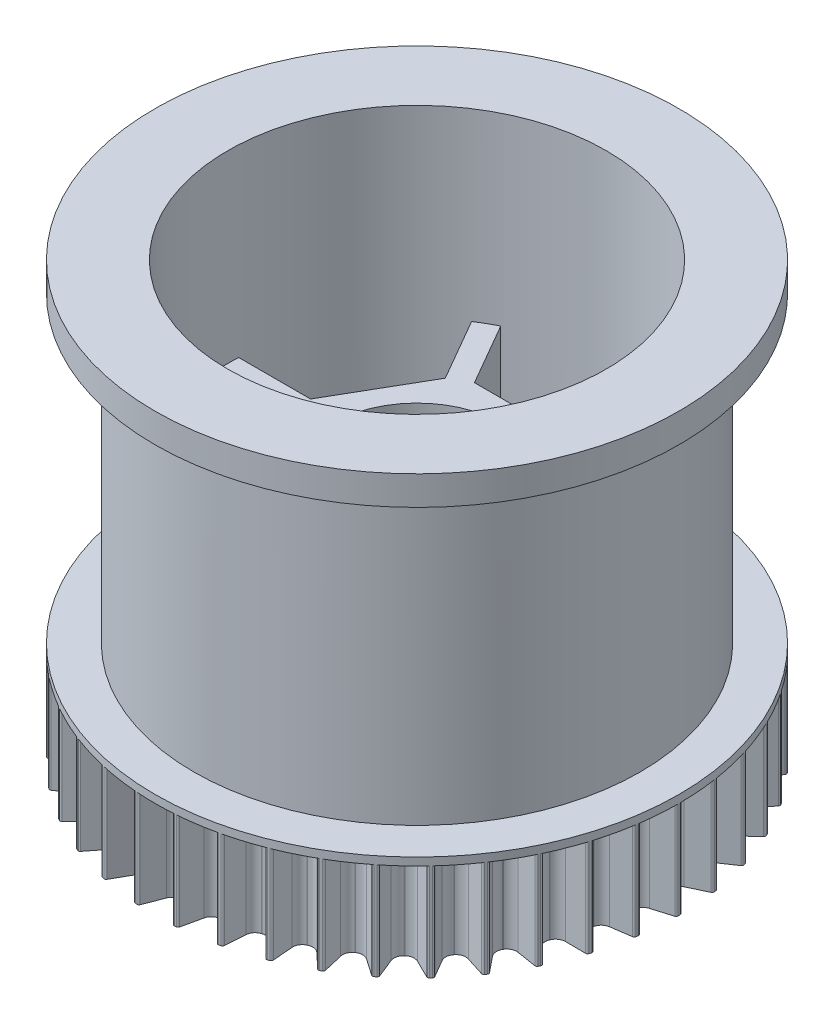
from build123d import *

# Parameters (mm, degrees)
SKETCH_1_R          = 4.4
EXTRUDE_1_DEPTH     = 5
SKETCH_2_R          = 13.5
SKETCH_2_R_2        = 11.2
EXTRUDE_2_DEPTH     = 0.4
SKETCH_2_2_R        = 11.5
SKETCH_2_2_R_2      = 10.9
EXTRUDE_2_2_DEPTH   = 16
SKETCH_5_R          = 13.5
SKETCH_5_R_2        = 10.9
EXTRUDE_3_DEPTH     = 1.5
SKETCH_6_R          = 4.4
EXTRUDE_4_DEPTH     = 8
SKETCH_1_6_R        = 4.4
SKETCH_1_6_R_2      = 3.5
EXTRUDE_5_DEPTH     = 13
SKETCH_1_7_R        = 4.4
SKETCH_1_7_R_2      = 3.5
CUT_EXTRUDE_1_DEPTH = 3
CUT_EXTRUDE_START   = -3
SKETCH_8_R          = 4.4
SKETCH_8_R_2        = 3.5
CUT_EXTRUDE_2_DEPTH = 3
EXTRUDE_7_REACH     = 31.508
SKETCH_9_R          = 11.5
SKETCH_9_R_2        = 9.75


with BuildPart() as part:
    # 草图1 → 凸台-拉伸1 (new body)
    with BuildSketch(Plane(origin=(0, 0, 0), x_dir=(1, 0, 0), z_dir=(0, 1, 0))):
        with BuildLine():
            Line((12.421648835, 0.449416948), (13.428727986, 0.146279171))
            ThreePointArc((13.428727986, 0.146279171), (13.480048996, 0.110330314), (13.499904043, 0.050900158))
            ThreePointArc((13.499904043, 0.050900158), (13.5, 0), (13.499904043, -0.050900158))
            ThreePointArc((13.499904043, -0.050900158), (13.480048996, -0.110330314), (13.428727986, -0.146279171))
            Line((13.428727986, -0.146279171), (12.421648835, -0.449416948))
            ThreePointArc((12.421648835, -0.449416948), (12.175747513, -0.615329239), (12.067123529, -0.89136398))
            ThreePointArc((12.067123529, -0.89136398), (12.066165946, -0.904234132), (12.065194637, -0.917103256))
            ThreePointArc((12.065194637, -0.917103256), (12.131464538, -1.206244482), (12.349891401, -1.40695336))
            Line((12.349891401, -1.40695336), (13.300541969, -1.856802698))
            ThreePointArc((13.300541969, -1.856802698), (13.345931866, -1.899999035), (13.356707544, -1.961724646))
            ThreePointArc((13.356707544, -1.961724646), (13.349216154, -2.012070593), (13.341534994, -2.062387937))
            ThreePointArc((13.341534994, -2.062387937), (13.313044106, -2.118195066), (13.256938411, -2.146093404))
            Line((13.256938411, -2.146093404), (12.21592716, -2.295748024))
            ThreePointArc((12.21592716, -2.295748024), (11.948044409, -2.423157522), (11.799492821, -2.679919618))
            ThreePointArc((11.799492821, -2.679919618), (11.796627737, -2.692503301), (11.793749233, -2.705083921))
            ThreePointArc((11.793749233, -2.705083921), (11.816184691, -3.000872694), (12.0022578, -3.231894655))
            Line((12.0022578, -3.231894655), (12.875243823, -3.818406662))
            ThreePointArc((12.875243823, -3.818406662), (12.913688672, -3.867885545), (12.915144269, -3.930527764))
            ThreePointArc((12.915144269, -3.930527764), (12.900232878, -3.979194855), (12.885138099, -4.027805378))
            ThreePointArc((12.885138099, -4.027805378), (12.84864781, -4.07874284), (12.789010738, -4.097967457))
            Line((12.789010738, -4.097967457), (11.737321858, -4.090795883))
            ThreePointArc((11.737321858, -4.090795883), (11.453441736, -4.176856469), (11.268280943, -4.40861028))
            ThreePointArc((11.268280943, -4.40861028), (11.263572359, -4.420626395), (11.258850961, -4.432637481))
            ThreePointArc((11.258850961, -4.432637481), (11.236950804, -4.72846637), (11.386513594, -4.984640763))
            Line((11.386513594, -4.984640763), (12.162334005, -5.694713732))
            ThreePointArc((12.162334005, -5.694713732), (12.192975012, -5.749369884), (12.185078013, -5.811529386))
            ThreePointArc((12.185078013, -5.811529386), (12.163079717, -5.857430478), (12.140908512, -5.903248302))
            ThreePointArc((12.140908512, -5.903248302), (12.097233954, -5.94817824), (12.035397698, -5.958299689))
            Line((12.035397698, -5.958299689), (10.996524182, -5.794462121))
            ThreePointArc((10.996524182, -5.794462121), (10.702988102, -5.837251346), (10.485354288, -6.038819873))
            ThreePointArc((10.485354288, -6.038819873), (10.478907386, -6.05), (10.472448563, -6.061173244))
            ThreePointArc((10.472448563, -6.061173244), (10.406702004, -6.35043392), (10.51641349, -6.626038234))
            Line((10.51641349, -6.626038234), (11.177737743, -7.443810306))
            ThreePointArc((11.177737743, -7.443810306), (11.199890439, -7.5024228), (11.18281725, -7.562711045))
            ThreePointArc((11.18281725, -7.562711045), (11.154223453, -7.604820784), (11.12547109, -7.646822414))
            ThreePointArc((11.12547109, -7.646822414), (11.075587881, -7.684741166), (11.012933761, -7.685533352))
            Line((11.012933761, -7.685533352), (10.010082327, -7.368689651))
            ThreePointArc((10.010082327, -7.368689651), (9.713447399, -7.367251672), (9.468202145, -7.534132209))
            ThreePointArc((9.468202145, -7.534132209), (9.460160938, -7.544226602), (9.452108969, -7.554312413))
            ThreePointArc((9.452108969, -7.554312413), (9.343984679, -7.83054327), (9.411394086, -8.11942096))
            Line((9.411394086, -8.11942096), (9.943449291, -9.026624459))
            ThreePointArc((9.943449291, -9.026624459), (9.956618821, -9.087883988), (9.930750828, -9.144954237))
            ThreePointArc((9.930750828, -9.144954237), (9.89620027, -9.18233196), (9.861509029, -9.219579149))
            ThreePointArc((9.861509029, -9.219579149), (9.806531477, -9.249639674), (9.744459083, -9.241084899))
            Line((9.744459083, -9.241084899), (8.800031773, -8.778312831))
            ThreePointArc((8.800031773, -8.778312831), (8.506924332, -8.732679771), (8.239546012, -8.861144482))
            ThreePointArc((8.239546012, -8.861144482), (8.230090127, -8.869927649), (8.22062488, -8.878700726))
            ThreePointArc((8.22062488, -8.878700726), (8.072538176, -9.135731223), (8.09613969, -9.431429239))
            Line((8.09613969, -9.431429239), (8.487040612, -10.407798738))
            ThreePointArc((8.487040612, -10.407798738), (8.49093279, -10.470336865), (8.456847843, -10.522914262))
            ThreePointArc((8.456847843, -10.522914262), (8.417112325, -10.554725013), (8.377257151, -10.586385721))
            ThreePointArc((8.377257151, -10.586385721), (8.318413365, -10.607916516), (8.258309291, -10.59020588))
            Line((8.258309291, -10.59020588), (7.393403052, -9.991843007))
            ThreePointArc((7.393403052, -9.991843007), (7.110370633, -9.903034234), (6.826832036, -9.990213429))
            ThreePointArc((6.826832036, -9.990213429), (6.816172703, -9.997489169), (6.805505615, -10.004753536))
            ThreePointArc((6.805505615, -10.004753536), (6.620764509, -10.236842037), (6.600030911, -10.532754974))
            Line((6.600030911, -10.532754974), (6.841045471, -11.556479991))
            ThreePointArc((6.841045471, -11.556479991), (6.835573353, -11.618899718), (6.794032851, -11.665809771))
            ThreePointArc((6.794032851, -11.665809771), (6.75, -11.691342951), (6.705871192, -11.716709929))
            ThreePointArc((6.705871192, -11.716709929), (6.644475643, -11.729230032), (6.587682515, -11.702759162))
            Line((6.587682515, -11.702759162), (5.821617923, -10.982171922))
            ThreePointArc((5.821617923, -10.982171922), (5.554983004, -10.852171276), (5.261617913, -10.896117516))
            ThreePointArc((5.261617913, -10.896117516), (5.249993243, -10.901723302), (5.238362601, -10.907316685))
            ThreePointArc((5.238362601, -10.907316685), (5.021093904, -11.109278715), (4.956488349, -11.398796367))
            Line((4.956488349, -11.398796367), (5.042232678, -12.447008578))
            ThreePointArc((5.042232678, -12.447008578), (5.027518502, -12.507915551), (4.979450393, -12.548110367))
            ThreePointArc((4.979450393, -12.548110367), (4.932103829, -12.566795607), (4.884687151, -12.585302199))
            ThreePointArc((4.884687151, -12.585302199), (4.822111316, -12.588531931), (4.769897799, -12.553892142))
            Line((4.769897799, -12.553892142), (4.11978747, -11.727177263))
            ThreePointArc((4.11978747, -11.727177263), (3.875506233, -11.558888745), (3.578867941, -11.558620344))
            ThreePointArc((3.578867941, -11.558620344), (3.56653761, -11.56243095), (3.554203222, -11.566228402))
            ThreePointArc((3.554203222, -11.566228402), (3.309260359, -11.733552465), (3.202226027, -12.010207485))
            Line((3.202226027, -12.010207485), (3.13078474, -13.059491561))
            ThreePointArc((3.13078474, -13.059491561), (3.107157195, -13.117525219), (3.053635241, -13.150106913))
            ThreePointArc((3.053635241, -13.150106913), (3.004032608, -13.161526814), (2.954387271, -13.172759614))
            ThreePointArc((2.954387271, -13.172759614), (2.89202899, -13.166626828), (2.845561447, -13.124591917))
            Line((2.845561447, -13.124591917), (2.325927773, -12.210216843))
            ThreePointArc((2.325927773, -12.210216843), (2.109457058, -12.007399739), (1.816171974, -11.962922693))
            ThreePointArc((1.816171974, -11.962922693), (1.803411421, -11.964852997), (1.790648816, -11.96676969))
            ThreePointArc((1.790648816, -11.96676969), (1.523503405, -12.095718042), (1.376431267, -12.353330415))
            Line((1.376431267, -12.353330415), (1.149400244, -13.380247083))
            ThreePointArc((1.149400244, -13.380247083), (1.117387131, -13.43411105), (1.059606923, -13.4583518))
            ThreePointArc((1.059606923, -13.4583518), (1.008856263, -13.462251262), (0.958091262, -13.465959347))
            ThreePointArc((0.958091262, -13.465959347), (0.897343515, -13.45060104), (0.857659955, -13.402109995))
            Line((0.857659955, -13.402109995), (0.480110693, -12.420500356))
            ThreePointArc((0.480110693, -12.420500356), (0.296286097, -12.187685265), (0.012905725, -12.099993117))
            ThreePointArc((0.012905725, -12.099993117), (0, -12.1), (-0.012905725, -12.099993117))
            ThreePointArc((-0.012905725, -12.099993117), (-0.296286097, -12.187685265), (-0.480110693, -12.420500356))
            Line((-0.480110693, -12.420500356), (-0.857659955, -13.402109995))
            ThreePointArc((-0.857659955, -13.402109995), (-0.897343515, -13.45060104), (-0.958091262, -13.465959347))
            ThreePointArc((-0.958091262, -13.465959347), (-1.008856263, -13.462251262), (-1.059606923, -13.4583518))
            ThreePointArc((-1.059606923, -13.4583518), (-1.117387131, -13.43411105), (-1.149400244, -13.380247083))
            Line((-1.149400244, -13.380247083), (-1.376431267, -12.353330415))
            ThreePointArc((-1.376431267, -12.353330415), (-1.523503405, -12.095718042), (-1.790648816, -11.96676969))
            ThreePointArc((-1.790648816, -11.96676969), (-1.803411421, -11.964852997), (-1.816171974, -11.962922693))
            ThreePointArc((-1.816171974, -11.962922693), (-2.109457058, -12.007399739), (-2.325927773, -12.210216843))
            Line((-2.325927773, -12.210216843), (-2.845561447, -13.124591917))
            ThreePointArc((-2.845561447, -13.124591917), (-2.89202899, -13.166626828), (-2.954387271, -13.172759614))
            ThreePointArc((-2.954387271, -13.172759614), (-3.004032608, -13.161526814), (-3.053635241, -13.150106913))
            ThreePointArc((-3.053635241, -13.150106913), (-3.107157195, -13.117525219), (-3.13078474, -13.059491561))
            Line((-3.13078474, -13.059491561), (-3.202226027, -12.010207485))
            ThreePointArc((-3.202226027, -12.010207485), (-3.309260359, -11.733552465), (-3.554203222, -11.566228402))
            ThreePointArc((-3.554203222, -11.566228402), (-3.56653761, -11.56243095), (-3.578867941, -11.558620344))
            ThreePointArc((-3.578867941, -11.558620344), (-3.875506233, -11.558888745), (-4.11978747, -11.727177263))
            Line((-4.11978747, -11.727177263), (-4.769897799, -12.553892142))
            ThreePointArc((-4.769897799, -12.553892142), (-4.822111316, -12.588531931), (-4.884687151, -12.585302199))
            ThreePointArc((-4.884687151, -12.585302199), (-4.932103829, -12.566795607), (-4.979450393, -12.548110367))
            ThreePointArc((-4.979450393, -12.548110367), (-5.027518502, -12.507915551), (-5.042232678, -12.447008578))
            Line((-5.042232678, -12.447008578), (-4.956488349, -11.398796367))
            ThreePointArc((-4.956488349, -11.398796367), (-5.021093904, -11.109278715), (-5.238362601, -10.907316685))
            ThreePointArc((-5.238362601, -10.907316685), (-5.249993243, -10.901723302), (-5.261617913, -10.896117516))
            ThreePointArc((-5.261617913, -10.896117516), (-5.554983004, -10.852171276), (-5.821617923, -10.982171922))
            Line((-5.821617923, -10.982171922), (-6.587682515, -11.702759162))
            ThreePointArc((-6.587682515, -11.702759162), (-6.644475643, -11.729230032), (-6.705871192, -11.716709929))
            ThreePointArc((-6.705871192, -11.716709929), (-6.75, -11.691342951), (-6.794032851, -11.665809771))
            ThreePointArc((-6.794032851, -11.665809771), (-6.835573353, -11.618899718), (-6.841045471, -11.556479991))
            Line((-6.841045471, -11.556479991), (-6.600030911, -10.532754974))
            ThreePointArc((-6.600030911, -10.532754974), (-6.620764509, -10.236842037), (-6.805505615, -10.004753536))
            ThreePointArc((-6.805505615, -10.004753536), (-6.816172703, -9.997489169), (-6.826832036, -9.990213429))
            ThreePointArc((-6.826832036, -9.990213429), (-7.110370633, -9.903034234), (-7.393403052, -9.991843007))
            Line((-7.393403052, -9.991843007), (-8.258309291, -10.59020588))
            ThreePointArc((-8.258309291, -10.59020588), (-8.318413365, -10.607916516), (-8.377257151, -10.586385721))
            ThreePointArc((-8.377257151, -10.586385721), (-8.417112325, -10.554725013), (-8.456847843, -10.522914262))
            ThreePointArc((-8.456847843, -10.522914262), (-8.49093279, -10.470336865), (-8.487040612, -10.407798738))
            Line((-8.487040612, -10.407798738), (-8.09613969, -9.431429239))
            ThreePointArc((-8.09613969, -9.431429239), (-8.072538176, -9.135731223), (-8.22062488, -8.878700726))
            ThreePointArc((-8.22062488, -8.878700726), (-8.230090127, -8.869927649), (-8.239546012, -8.861144482))
            ThreePointArc((-8.239546012, -8.861144482), (-8.506924332, -8.732679771), (-8.800031773, -8.778312831))
            Line((-8.800031773, -8.778312831), (-9.744459083, -9.241084899))
            ThreePointArc((-9.744459083, -9.241084899), (-9.806531477, -9.249639674), (-9.861509029, -9.219579149))
            ThreePointArc((-9.861509029, -9.219579149), (-9.89620027, -9.18233196), (-9.930750828, -9.144954237))
            ThreePointArc((-9.930750828, -9.144954237), (-9.956618821, -9.087883988), (-9.943449291, -9.026624459))
            Line((-9.943449291, -9.026624459), (-9.411394086, -8.11942096))
            ThreePointArc((-9.411394086, -8.11942096), (-9.343984679, -7.83054327), (-9.452108969, -7.554312413))
            ThreePointArc((-9.452108969, -7.554312413), (-9.460160938, -7.544226602), (-9.468202145, -7.534132209))
            ThreePointArc((-9.468202145, -7.534132209), (-9.713447399, -7.367251672), (-10.010082327, -7.368689651))
            Line((-10.010082327, -7.368689651), (-11.012933761, -7.685533352))
            ThreePointArc((-11.012933761, -7.685533352), (-11.075587881, -7.684741166), (-11.12547109, -7.646822414))
            ThreePointArc((-11.12547109, -7.646822414), (-11.154223453, -7.604820784), (-11.18281725, -7.562711045))
            ThreePointArc((-11.18281725, -7.562711045), (-11.199890439, -7.5024228), (-11.177737743, -7.443810306))
            Line((-11.177737743, -7.443810306), (-10.51641349, -6.626038234))
            ThreePointArc((-10.51641349, -6.626038234), (-10.406702004, -6.35043392), (-10.472448563, -6.061173244))
            ThreePointArc((-10.472448563, -6.061173244), (-10.478907386, -6.05), (-10.485354288, -6.038819873))
            ThreePointArc((-10.485354288, -6.038819873), (-10.702988102, -5.837251346), (-10.996524182, -5.794462121))
            Line((-10.996524182, -5.794462121), (-12.035397698, -5.958299689))
            ThreePointArc((-12.035397698, -5.958299689), (-12.097233954, -5.94817824), (-12.140908512, -5.903248302))
            ThreePointArc((-12.140908512, -5.903248302), (-12.163079717, -5.857430478), (-12.185078013, -5.811529386))
            ThreePointArc((-12.185078013, -5.811529386), (-12.192975012, -5.749369884), (-12.162334005, -5.694713732))
            Line((-12.162334005, -5.694713732), (-11.386513594, -4.984640763))
            ThreePointArc((-11.386513594, -4.984640763), (-11.236950804, -4.72846637), (-11.258850961, -4.432637481))
            ThreePointArc((-11.258850961, -4.432637481), (-11.263572359, -4.420626395), (-11.268280943, -4.40861028))
            ThreePointArc((-11.268280943, -4.40861028), (-11.453441736, -4.176856469), (-11.737321858, -4.090795883))
            Line((-11.737321858, -4.090795883), (-12.789010738, -4.097967457))
            ThreePointArc((-12.789010738, -4.097967457), (-12.84864781, -4.07874284), (-12.885138099, -4.027805378))
            ThreePointArc((-12.885138099, -4.027805378), (-12.900232878, -3.979194855), (-12.915144269, -3.930527764))
            ThreePointArc((-12.915144269, -3.930527764), (-12.913688672, -3.867885545), (-12.875243823, -3.818406662))
            Line((-12.875243823, -3.818406662), (-12.0022578, -3.231894655))
            ThreePointArc((-12.0022578, -3.231894655), (-11.816184691, -3.000872694), (-11.793749233, -2.705083921))
            ThreePointArc((-11.793749233, -2.705083921), (-11.796627737, -2.692503301), (-11.799492821, -2.679919618))
            ThreePointArc((-11.799492821, -2.679919618), (-11.948044409, -2.423157522), (-12.21592716, -2.295748024))
            Line((-12.21592716, -2.295748024), (-13.256938411, -2.146093404))
            ThreePointArc((-13.256938411, -2.146093404), (-13.313044106, -2.118195066), (-13.341534994, -2.062387937))
            ThreePointArc((-13.341534994, -2.062387937), (-13.349216154, -2.012070593), (-13.356707544, -1.961724646))
            ThreePointArc((-13.356707544, -1.961724646), (-13.345931866, -1.899999035), (-13.300541969, -1.856802698))
            Line((-13.300541969, -1.856802698), (-12.349891401, -1.40695336))
            ThreePointArc((-12.349891401, -1.40695336), (-12.131464538, -1.206244482), (-12.065194637, -0.917103256))
            ThreePointArc((-12.065194637, -0.917103256), (-12.066165946, -0.904234132), (-12.067123529, -0.89136398))
            ThreePointArc((-12.067123529, -0.89136398), (-12.175747513, -0.615329239), (-12.421648835, -0.449416948))
            Line((-12.421648835, -0.449416948), (-13.428727986, -0.146279171))
            ThreePointArc((-13.428727986, -0.146279171), (-13.480048996, -0.110330314), (-13.499904043, -0.050900158))
            ThreePointArc((-13.499904043, -0.050900158), (-13.5, 0), (-13.499904043, 0.050900158))
            ThreePointArc((-13.499904043, 0.050900158), (-13.480048996, 0.110330314), (-13.428727986, 0.146279171))
            Line((-13.428727986, 0.146279171), (-12.421648835, 0.449416948))
            ThreePointArc((-12.421648835, 0.449416948), (-12.175747513, 0.615329239), (-12.067123529, 0.89136398))
            ThreePointArc((-12.067123529, 0.89136398), (-12.066165946, 0.904234132), (-12.065194637, 0.917103256))
            ThreePointArc((-12.065194637, 0.917103256), (-12.131464538, 1.206244482), (-12.349891401, 1.40695336))
            Line((-12.349891401, 1.40695336), (-13.300541969, 1.856802698))
            ThreePointArc((-13.300541969, 1.856802698), (-13.345931866, 1.899999035), (-13.356707544, 1.961724646))
            ThreePointArc((-13.356707544, 1.961724646), (-13.349216154, 2.012070593), (-13.341534994, 2.062387937))
            ThreePointArc((-13.341534994, 2.062387937), (-13.313044106, 2.118195066), (-13.256938411, 2.146093404))
            Line((-13.256938411, 2.146093404), (-12.21592716, 2.295748024))
            ThreePointArc((-12.21592716, 2.295748024), (-11.948044409, 2.423157522), (-11.799492821, 2.679919618))
            ThreePointArc((-11.799492821, 2.679919618), (-11.796627737, 2.692503301), (-11.793749233, 2.705083921))
            ThreePointArc((-11.793749233, 2.705083921), (-11.816184691, 3.000872694), (-12.0022578, 3.231894655))
            Line((-12.0022578, 3.231894655), (-12.875243823, 3.818406662))
            ThreePointArc((-12.875243823, 3.818406662), (-12.913688672, 3.867885545), (-12.915144269, 3.930527764))
            ThreePointArc((-12.915144269, 3.930527764), (-12.900232878, 3.979194855), (-12.885138099, 4.027805378))
            ThreePointArc((-12.885138099, 4.027805378), (-12.84864781, 4.07874284), (-12.789010738, 4.097967457))
            Line((-12.789010738, 4.097967457), (-11.737321858, 4.090795883))
            ThreePointArc((-11.737321858, 4.090795883), (-11.453441736, 4.176856469), (-11.268280943, 4.40861028))
            ThreePointArc((-11.268280943, 4.40861028), (-11.263572359, 4.420626395), (-11.258850961, 4.432637481))
            ThreePointArc((-11.258850961, 4.432637481), (-11.236950804, 4.72846637), (-11.386513594, 4.984640763))
            Line((-11.386513594, 4.984640763), (-12.162334005, 5.694713732))
            ThreePointArc((-12.162334005, 5.694713732), (-12.192975012, 5.749369884), (-12.185078013, 5.811529386))
            ThreePointArc((-12.185078013, 5.811529386), (-12.163079717, 5.857430478), (-12.140908512, 5.903248302))
            ThreePointArc((-12.140908512, 5.903248302), (-12.097233954, 5.94817824), (-12.035397698, 5.958299689))
            Line((-12.035397698, 5.958299689), (-10.996524182, 5.794462121))
            ThreePointArc((-10.996524182, 5.794462121), (-10.702988102, 5.837251346), (-10.485354288, 6.038819873))
            ThreePointArc((-10.485354288, 6.038819873), (-10.478907386, 6.05), (-10.472448563, 6.061173244))
            ThreePointArc((-10.472448563, 6.061173244), (-10.406702004, 6.35043392), (-10.51641349, 6.626038234))
            Line((-10.51641349, 6.626038234), (-11.177737743, 7.443810306))
            ThreePointArc((-11.177737743, 7.443810306), (-11.199890439, 7.5024228), (-11.18281725, 7.562711045))
            ThreePointArc((-11.18281725, 7.562711045), (-11.154223453, 7.604820784), (-11.12547109, 7.646822414))
            ThreePointArc((-11.12547109, 7.646822414), (-11.075587881, 7.684741166), (-11.012933761, 7.685533352))
            Line((-11.012933761, 7.685533352), (-10.010082327, 7.368689651))
            ThreePointArc((-10.010082327, 7.368689651), (-9.713447399, 7.367251672), (-9.468202145, 7.534132209))
            ThreePointArc((-9.468202145, 7.534132209), (-9.460160938, 7.544226602), (-9.452108969, 7.554312413))
            ThreePointArc((-9.452108969, 7.554312413), (-9.343984679, 7.83054327), (-9.411394086, 8.11942096))
            Line((-9.411394086, 8.11942096), (-9.943449291, 9.026624459))
            ThreePointArc((-9.943449291, 9.026624459), (-9.956618821, 9.087883988), (-9.930750828, 9.144954237))
            ThreePointArc((-9.930750828, 9.144954237), (-9.89620027, 9.18233196), (-9.861509029, 9.219579149))
            ThreePointArc((-9.861509029, 9.219579149), (-9.806531477, 9.249639674), (-9.744459083, 9.241084899))
            Line((-9.744459083, 9.241084899), (-8.800031773, 8.778312831))
            ThreePointArc((-8.800031773, 8.778312831), (-8.506924332, 8.732679771), (-8.239546012, 8.861144482))
            ThreePointArc((-8.239546012, 8.861144482), (-8.230090127, 8.869927649), (-8.22062488, 8.878700726))
            ThreePointArc((-8.22062488, 8.878700726), (-8.072538176, 9.135731223), (-8.09613969, 9.431429239))
            Line((-8.09613969, 9.431429239), (-8.487040612, 10.407798738))
            ThreePointArc((-8.487040612, 10.407798738), (-8.49093279, 10.470336865), (-8.456847843, 10.522914262))
            ThreePointArc((-8.456847843, 10.522914262), (-8.417112325, 10.554725013), (-8.377257151, 10.586385721))
            ThreePointArc((-8.377257151, 10.586385721), (-8.318413365, 10.607916516), (-8.258309291, 10.59020588))
            Line((-8.258309291, 10.59020588), (-7.393403052, 9.991843007))
            ThreePointArc((-7.393403052, 9.991843007), (-7.110370633, 9.903034234), (-6.826832036, 9.990213429))
            ThreePointArc((-6.826832036, 9.990213429), (-6.816172703, 9.997489169), (-6.805505615, 10.004753536))
            ThreePointArc((-6.805505615, 10.004753536), (-6.620764509, 10.236842037), (-6.600030911, 10.532754974))
            Line((-6.600030911, 10.532754974), (-6.841045471, 11.556479991))
            ThreePointArc((-6.841045471, 11.556479991), (-6.835573353, 11.618899718), (-6.794032851, 11.665809771))
            ThreePointArc((-6.794032851, 11.665809771), (-6.75, 11.691342951), (-6.705871192, 11.716709929))
            ThreePointArc((-6.705871192, 11.716709929), (-6.644475643, 11.729230032), (-6.587682515, 11.702759162))
            Line((-6.587682515, 11.702759162), (-5.821617923, 10.982171922))
            ThreePointArc((-5.821617923, 10.982171922), (-5.554983004, 10.852171276), (-5.261617913, 10.896117516))
            ThreePointArc((-5.261617913, 10.896117516), (-5.249993243, 10.901723302), (-5.238362601, 10.907316685))
            ThreePointArc((-5.238362601, 10.907316685), (-5.021093904, 11.109278715), (-4.956488349, 11.398796367))
            Line((-4.956488349, 11.398796367), (-5.042232678, 12.447008578))
            ThreePointArc((-5.042232678, 12.447008578), (-5.027518502, 12.507915551), (-4.979450393, 12.548110367))
            ThreePointArc((-4.979450393, 12.548110367), (-4.932103829, 12.566795607), (-4.884687151, 12.585302199))
            ThreePointArc((-4.884687151, 12.585302199), (-4.822111316, 12.588531931), (-4.769897799, 12.553892142))
            Line((-4.769897799, 12.553892142), (-4.11978747, 11.727177263))
            ThreePointArc((-4.11978747, 11.727177263), (-3.875506233, 11.558888745), (-3.578867941, 11.558620344))
            ThreePointArc((-3.578867941, 11.558620344), (-3.56653761, 11.56243095), (-3.554203222, 11.566228402))
            ThreePointArc((-3.554203222, 11.566228402), (-3.309260359, 11.733552465), (-3.202226027, 12.010207485))
            Line((-3.202226027, 12.010207485), (-3.13078474, 13.059491561))
            ThreePointArc((-3.13078474, 13.059491561), (-3.107157195, 13.117525219), (-3.053635241, 13.150106913))
            ThreePointArc((-3.053635241, 13.150106913), (-3.004032608, 13.161526814), (-2.954387271, 13.172759614))
            ThreePointArc((-2.954387271, 13.172759614), (-2.89202899, 13.166626828), (-2.845561447, 13.124591917))
            Line((-2.845561447, 13.124591917), (-2.325927773, 12.210216843))
            ThreePointArc((-2.325927773, 12.210216843), (-2.109457058, 12.007399739), (-1.816171974, 11.962922693))
            ThreePointArc((-1.816171974, 11.962922693), (-1.803411421, 11.964852997), (-1.790648816, 11.96676969))
            ThreePointArc((-1.790648816, 11.96676969), (-1.523503405, 12.095718042), (-1.376431267, 12.353330415))
            Line((-1.376431267, 12.353330415), (-1.149400244, 13.380247083))
            ThreePointArc((-1.149400244, 13.380247083), (-1.117387131, 13.43411105), (-1.059606923, 13.4583518))
            ThreePointArc((-1.059606923, 13.4583518), (-1.008856263, 13.462251262), (-0.958091262, 13.465959347))
            ThreePointArc((-0.958091262, 13.465959347), (-0.897343515, 13.45060104), (-0.857659955, 13.402109995))
            Line((-0.857659955, 13.402109995), (-0.480110693, 12.420500356))
            ThreePointArc((-0.480110693, 12.420500356), (-0.296286097, 12.187685265), (-0.012905725, 12.099993117))
            ThreePointArc((-0.012905725, 12.099993117), (0, 12.1), (0.012905725, 12.099993117))
            ThreePointArc((0.012905725, 12.099993117), (0.296286097, 12.187685265), (0.480110693, 12.420500356))
            Line((0.480110693, 12.420500356), (0.857659955, 13.402109995))
            ThreePointArc((0.857659955, 13.402109995), (0.897343515, 13.45060104), (0.958091262, 13.465959347))
            ThreePointArc((0.958091262, 13.465959347), (1.008856263, 13.462251262), (1.059606923, 13.4583518))
            ThreePointArc((1.059606923, 13.4583518), (1.117387131, 13.43411105), (1.149400244, 13.380247083))
            Line((1.149400244, 13.380247083), (1.376431267, 12.353330415))
            ThreePointArc((1.376431267, 12.353330415), (1.523503405, 12.095718042), (1.790648816, 11.96676969))
            ThreePointArc((1.790648816, 11.96676969), (1.803411421, 11.964852997), (1.816171974, 11.962922693))
            ThreePointArc((1.816171974, 11.962922693), (2.109457058, 12.007399739), (2.325927773, 12.210216843))
            Line((2.325927773, 12.210216843), (2.845561447, 13.124591917))
            ThreePointArc((2.845561447, 13.124591917), (2.89202899, 13.166626828), (2.954387271, 13.172759614))
            ThreePointArc((2.954387271, 13.172759614), (3.004032608, 13.161526814), (3.053635241, 13.150106913))
            ThreePointArc((3.053635241, 13.150106913), (3.107157195, 13.117525219), (3.13078474, 13.059491561))
            Line((3.13078474, 13.059491561), (3.202226027, 12.010207485))
            ThreePointArc((3.202226027, 12.010207485), (3.309260359, 11.733552465), (3.554203222, 11.566228402))
            ThreePointArc((3.554203222, 11.566228402), (3.56653761, 11.56243095), (3.578867941, 11.558620344))
            ThreePointArc((3.578867941, 11.558620344), (3.875506233, 11.558888745), (4.11978747, 11.727177263))
            Line((4.11978747, 11.727177263), (4.769897799, 12.553892142))
            ThreePointArc((4.769897799, 12.553892142), (4.822111316, 12.588531931), (4.884687151, 12.585302199))
            ThreePointArc((4.884687151, 12.585302199), (4.932103829, 12.566795607), (4.979450393, 12.548110367))
            ThreePointArc((4.979450393, 12.548110367), (5.027518502, 12.507915551), (5.042232678, 12.447008578))
            Line((5.042232678, 12.447008578), (4.956488349, 11.398796367))
            ThreePointArc((4.956488349, 11.398796367), (5.021093904, 11.109278715), (5.238362601, 10.907316685))
            ThreePointArc((5.238362601, 10.907316685), (5.249993243, 10.901723302), (5.261617913, 10.896117516))
            ThreePointArc((5.261617913, 10.896117516), (5.554983004, 10.852171276), (5.821617923, 10.982171922))
            Line((5.821617923, 10.982171922), (6.587682515, 11.702759162))
            ThreePointArc((6.587682515, 11.702759162), (6.644475643, 11.729230032), (6.705871192, 11.716709929))
            ThreePointArc((6.705871192, 11.716709929), (6.75, 11.691342951), (6.794032851, 11.665809771))
            ThreePointArc((6.794032851, 11.665809771), (6.835573353, 11.618899718), (6.841045471, 11.556479991))
            Line((6.841045471, 11.556479991), (6.600030911, 10.532754974))
            ThreePointArc((6.600030911, 10.532754974), (6.620764509, 10.236842037), (6.805505615, 10.004753536))
            ThreePointArc((6.805505615, 10.004753536), (6.816172703, 9.997489169), (6.826832036, 9.990213429))
            ThreePointArc((6.826832036, 9.990213429), (7.110370633, 9.903034234), (7.393403052, 9.991843007))
            Line((7.393403052, 9.991843007), (8.258309291, 10.59020588))
            ThreePointArc((8.258309291, 10.59020588), (8.318413365, 10.607916516), (8.377257151, 10.586385721))
            ThreePointArc((8.377257151, 10.586385721), (8.417112325, 10.554725013), (8.456847843, 10.522914262))
            ThreePointArc((8.456847843, 10.522914262), (8.49093279, 10.470336865), (8.487040612, 10.407798738))
            Line((8.487040612, 10.407798738), (8.09613969, 9.431429239))
            ThreePointArc((8.09613969, 9.431429239), (8.072538176, 9.135731223), (8.22062488, 8.878700726))
            ThreePointArc((8.22062488, 8.878700726), (8.230090127, 8.869927649), (8.239546012, 8.861144482))
            ThreePointArc((8.239546012, 8.861144482), (8.506924332, 8.732679771), (8.800031773, 8.778312831))
            Line((8.800031773, 8.778312831), (9.744459083, 9.241084899))
            ThreePointArc((9.744459083, 9.241084899), (9.806531477, 9.249639674), (9.861509029, 9.219579149))
            ThreePointArc((9.861509029, 9.219579149), (9.89620027, 9.18233196), (9.930750828, 9.144954237))
            ThreePointArc((9.930750828, 9.144954237), (9.956618821, 9.087883988), (9.943449291, 9.026624459))
            Line((9.943449291, 9.026624459), (9.411394086, 8.11942096))
            ThreePointArc((9.411394086, 8.11942096), (9.343984679, 7.83054327), (9.452108969, 7.554312413))
            ThreePointArc((9.452108969, 7.554312413), (9.460160938, 7.544226602), (9.468202145, 7.534132209))
            ThreePointArc((9.468202145, 7.534132209), (9.713447399, 7.367251672), (10.010082327, 7.368689651))
            Line((10.010082327, 7.368689651), (11.012933761, 7.685533352))
            ThreePointArc((11.012933761, 7.685533352), (11.075587881, 7.684741166), (11.12547109, 7.646822414))
            ThreePointArc((11.12547109, 7.646822414), (11.154223453, 7.604820784), (11.18281725, 7.562711045))
            ThreePointArc((11.18281725, 7.562711045), (11.199890439, 7.5024228), (11.177737743, 7.443810306))
            Line((11.177737743, 7.443810306), (10.51641349, 6.626038234))
            ThreePointArc((10.51641349, 6.626038234), (10.406702004, 6.35043392), (10.472448563, 6.061173244))
            ThreePointArc((10.472448563, 6.061173244), (10.478907386, 6.05), (10.485354288, 6.038819873))
            ThreePointArc((10.485354288, 6.038819873), (10.702988102, 5.837251346), (10.996524182, 5.794462121))
            Line((10.996524182, 5.794462121), (12.035397698, 5.958299689))
            ThreePointArc((12.035397698, 5.958299689), (12.097233954, 5.94817824), (12.140908512, 5.903248302))
            ThreePointArc((12.140908512, 5.903248302), (12.163079717, 5.857430478), (12.185078013, 5.811529386))
            ThreePointArc((12.185078013, 5.811529386), (12.192975012, 5.749369884), (12.162334005, 5.694713732))
            Line((12.162334005, 5.694713732), (11.386513594, 4.984640763))
            ThreePointArc((11.386513594, 4.984640763), (11.236950804, 4.72846637), (11.258850961, 4.432637481))
            ThreePointArc((11.258850961, 4.432637481), (11.263572359, 4.420626395), (11.268280943, 4.40861028))
            ThreePointArc((11.268280943, 4.40861028), (11.453441736, 4.176856469), (11.737321858, 4.090795883))
            Line((11.737321858, 4.090795883), (12.789010738, 4.097967457))
            ThreePointArc((12.789010738, 4.097967457), (12.84864781, 4.07874284), (12.885138099, 4.027805378))
            ThreePointArc((12.885138099, 4.027805378), (12.900232878, 3.979194855), (12.915144269, 3.930527764))
            ThreePointArc((12.915144269, 3.930527764), (12.913688672, 3.867885545), (12.875243823, 3.818406662))
            Line((12.875243823, 3.818406662), (12.0022578, 3.231894655))
            ThreePointArc((12.0022578, 3.231894655), (11.816184691, 3.000872694), (11.793749233, 2.705083921))
            ThreePointArc((11.793749233, 2.705083921), (11.796627737, 2.692503301), (11.799492821, 2.679919618))
            ThreePointArc((11.799492821, 2.679919618), (11.948044409, 2.423157522), (12.21592716, 2.295748024))
            Line((12.21592716, 2.295748024), (13.256938411, 2.146093404))
            ThreePointArc((13.256938411, 2.146093404), (13.313044106, 2.118195066), (13.341534994, 2.062387937))
            ThreePointArc((13.341534994, 2.062387937), (13.349216154, 2.012070593), (13.356707544, 1.961724646))
            ThreePointArc((13.356707544, 1.961724646), (13.345931866, 1.899999035), (13.300541969, 1.856802698))
            Line((13.300541969, 1.856802698), (12.349891401, 1.40695336))
            ThreePointArc((12.349891401, 1.40695336), (12.131464538, 1.206244482), (12.065194637, 0.917103256))
            ThreePointArc((12.065194637, 0.917103256), (12.066165946, 0.904234132), (12.067123529, 0.89136398))
            ThreePointArc((12.067123529, 0.89136398), (12.175747513, 0.615329239), (12.421648835, 0.449416948))
        make_face()
        with Locations(Location((0, 0, 0), (0, 0, 270))):
            Circle(SKETCH_1_R, mode=Mode.SUBTRACT)
        with BuildLine():
            Line((3.492969129, -4.95), (6.033310313, -0.55))
            Line((6.033310313, -0.55), (11.186487384, -0.55))
            ThreePointArc((11.186487384, -0.55), (9.699484522, -5.6), (6.069557664, -9.412782254))
            Line((6.069557664, -9.412782254), (3.492969129, -4.95))
        make_face(mode=Mode.SUBTRACT)
        with BuildLine():
            Line((2.540341184, -5.5), (-2.540341184, -5.5))
            Line((-2.540341184, -5.5), (-5.11692972, -9.962782254))
            ThreePointArc((-5.11692972, -9.962782254), (0, -11.2), (5.11692972, -9.962782254))
            Line((5.11692972, -9.962782254), (2.540341184, -5.5))
        make_face(mode=Mode.SUBTRACT)
        with BuildLine():
            Line((-3.492969129, -4.95), (-6.033310313, -0.55))
            Line((-6.033310313, -0.55), (-11.186487384, -0.55))
            ThreePointArc((-11.186487384, -0.55), (-9.699484522, -5.6), (-6.069557664, -9.412782254))
            Line((-6.069557664, -9.412782254), (-3.492969129, -4.95))
        make_face(mode=Mode.SUBTRACT)
        with BuildLine():
            Line((6.033310313, 0.55), (11.186487384, 0.55))
            ThreePointArc((11.186487384, 0.55), (9.699484522, 5.6), (6.069557664, 9.412782254))
            Line((6.069557664, 9.412782254), (3.492969129, 4.95))
            Line((3.492969129, 4.95), (6.033310313, 0.55))
        make_face(mode=Mode.SUBTRACT)
        with BuildLine():
            Line((-6.033310313, 0.55), (-11.186487384, 0.55))
            ThreePointArc((-11.186487384, 0.55), (-9.699484522, 5.6), (-6.069557664, 9.412782254))
            Line((-6.069557664, 9.412782254), (-3.492969129, 4.95))
            Line((-3.492969129, 4.95), (-6.033310313, 0.55))
        make_face(mode=Mode.SUBTRACT)
        with BuildLine():
            Line((-2.540341184, 5.5), (-5.11692972, 9.962782254))
            ThreePointArc((-5.11692972, 9.962782254), (0, 11.2), (5.11692972, 9.962782254))
            Line((5.11692972, 9.962782254), (2.540341184, 5.5))
            Line((2.540341184, 5.5), (-2.540341184, 5.5))
        make_face(mode=Mode.SUBTRACT)
    extrude(amount=EXTRUDE_1_DEPTH)

    # 草图2 → Extrude 2 (add)
    with BuildSketch(Plane(origin=(0, 5, 0), x_dir=(1, 0, 0), z_dir=(0, 1, 0))):
        with Locations(Location((0, 0, 0), (0, 0, 94.069686794))):
            Circle(SKETCH_2_R)
        with Locations(Location((0, 0, 0), (0, 0, 117.18523589))):
            Circle(SKETCH_2_R_2, mode=Mode.SUBTRACT)
    extrude(amount=EXTRUDE_2_DEPTH)

    # 草图2<2> → Extrude 2 2 (add)
    with BuildSketch(Plane(origin=(0, 5, 0), x_dir=(1, 0, 0), z_dir=(0, 1, 0))):
        Circle(SKETCH_2_2_R)
        Circle(SKETCH_2_2_R_2, mode=Mode.SUBTRACT)
    extrude(amount=EXTRUDE_2_2_DEPTH)

    # 草图5 → 凸台-拉伸3 (add)
    with BuildSketch(Plane(origin=(0, 21, 0), x_dir=(1, 0, 0), z_dir=(0, 1, 0))):
        with Locations(Location((0, 0, 0), (0, 0, 94.069686794))):
            Circle(SKETCH_5_R)
        with Locations(Location((0, 0, 0), (0, 0, 117.107700331))):
            Circle(SKETCH_5_R_2, mode=Mode.SUBTRACT)
    extrude(amount=EXTRUDE_3_DEPTH)

    # 草图6 → 凸台-拉伸4 (add)
    with BuildSketch(Plane(origin=(0, 5, 0), x_dir=(1, 0, 0), z_dir=(0, 1, 0))):
        with BuildLine():
            Line((-4.966743533, -9.702652147), (-2.540341184, -5.5))
            Line((-2.540341184, -5.5), (2.540341184, -5.5))
            Line((2.540341184, -5.5), (4.966743533, -9.702652147))
            ThreePointArc((4.966743533, -9.702652147), (5.45, -9.439676901), (5.919371477, -9.152652147))
            Line((5.919371477, -9.152652147), (3.492969129, -4.95))
            Line((3.492969129, -4.95), (6.033310313, -0.55))
            Line((6.033310313, -0.55), (10.886115009, -0.55))
            ThreePointArc((10.886115009, -0.55), (10.9, 0), (10.886115009, 0.55))
            Line((10.886115009, 0.55), (6.033310313, 0.55))
            Line((6.033310313, 0.55), (3.492969129, 4.95))
            Line((3.492969129, 4.95), (5.919371477, 9.152652147))
            ThreePointArc((5.919371477, 9.152652147), (5.45, 9.439676901), (4.966743533, 9.702652147))
            Line((4.966743533, 9.702652147), (2.540341184, 5.5))
            Line((2.540341184, 5.5), (-2.540341184, 5.5))
            Line((-2.540341184, 5.5), (-4.966743533, 9.702652147))
            ThreePointArc((-4.966743533, 9.702652147), (-5.45, 9.439676901), (-5.919371477, 9.152652147))
            Line((-5.919371477, 9.152652147), (-3.492969129, 4.95))
            Line((-3.492969129, 4.95), (-6.033310313, 0.55))
            Line((-6.033310313, 0.55), (-10.886115009, 0.55))
            ThreePointArc((-10.886115009, 0.55), (-10.9, 0), (-10.886115009, -0.55))
            Line((-10.886115009, -0.55), (-6.033310313, -0.55))
            Line((-6.033310313, -0.55), (-3.492969129, -4.95))
            Line((-3.492969129, -4.95), (-5.919371477, -9.152652147))
            ThreePointArc((-5.919371477, -9.152652147), (-5.45, -9.439676901), (-4.966743533, -9.702652147))
        make_face()
        with Locations(Location((0, 0, 0), (0, 0, 270))):
            Circle(SKETCH_6_R, mode=Mode.SUBTRACT)
    extrude(amount=EXTRUDE_4_DEPTH)

    # 草图1<6> → 凸台-拉伸5 (add)
    with BuildSketch(Plane(origin=(0, 0, 0), x_dir=(1, 0, 0), z_dir=(0, 1, 0))):
        Circle(SKETCH_1_6_R)
        with Locations(Location((0, 0, 0), (0, 0, 270))):
            Circle(SKETCH_1_6_R_2, mode=Mode.SUBTRACT)
    extrude(amount=EXTRUDE_5_DEPTH)

    # 草图1<7> → 切除-拉伸1 (cut)
    with BuildSketch(Plane(origin=(0, 0, 0), x_dir=(1, 0, 0), z_dir=(0, 1, 0))):
        with Locations(Location((0, 0, 0), (0, 0, 270))):
            Circle(SKETCH_1_7_R)
        with Locations(Location((0, 0, 0), (0, 0, 270))):
            Circle(SKETCH_1_7_R_2, mode=Mode.SUBTRACT)
    extrude(amount=CUT_EXTRUDE_1_DEPTH, mode=Mode.SUBTRACT)

    # 草图8 → 切除-拉伸2 (cut)
    with BuildSketch(Plane(origin=(0, 13, 0), x_dir=(1, 0, 0), z_dir=(0, 1, 0)).offset(CUT_EXTRUDE_START)):
        with Locations(Location((0, 0, 0), (0, 0, 270))):
            Circle(SKETCH_8_R)
        with Locations(Location((0, 0, 0), (0, 0, 270))):
            Circle(SKETCH_8_R_2, mode=Mode.SUBTRACT)
    extrude(amount=CUT_EXTRUDE_2_DEPTH, mode=Mode.SUBTRACT)

    # 凸台-拉伸7: up to this face of the body (flat: up to its plane)
    extrude_7_end = Plane(part.part.faces().sort_by_distance((13.009713737, 0, -2.079979342))[0])
    # 草图9 → 凸台-拉伸7 (add, up to the picked face)
    with BuildSketch(Plane(origin=(0, 22.5, 0), x_dir=(1, 0, 0), z_dir=(0, 1, 0)), mode=Mode.PRIVATE) as extrude_7_sk1:
        Circle(SKETCH_9_R)
        with Locations(Location((0, 0, 0), (0, 0, 270))):
            Circle(SKETCH_9_R_2, mode=Mode.SUBTRACT)
    extrude_7_tool1 = split(extrude(extrude_7_sk1.sketch, amount=-EXTRUDE_7_REACH, mode=Mode.PRIVATE), bisect_by=extrude_7_end, keep=Keep.BOTH, mode=Mode.PRIVATE)
    add(extrude_7_tool1.solids().sort_by(Axis((-11.174731, 22.5, 0), (0, -1, 0)))[0])


solid = part.part
